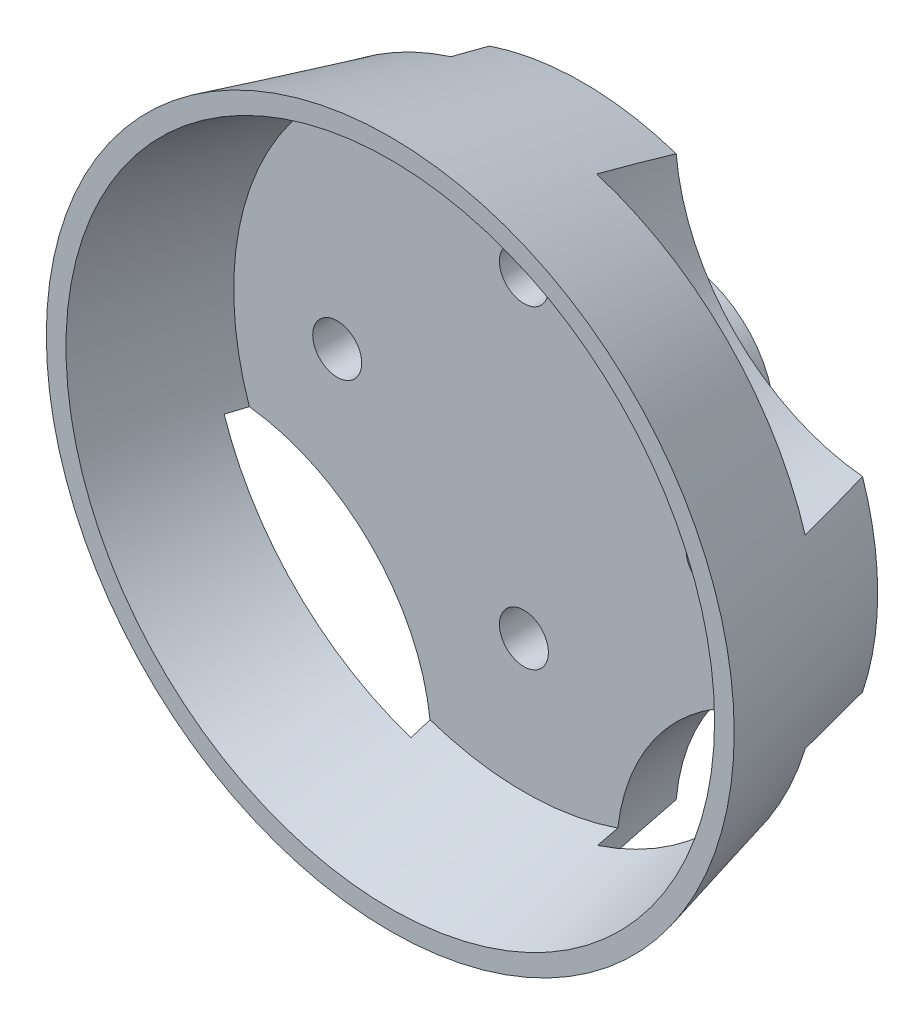
from build123d import *

# Parameters (mm, degrees)
SKETCH_2_R          = 1.245
SKETCH_2_R_2        = 10.5
CUT_EXTRUDE_1_DEPTH = 4
SKETCH_3_R          = 10.5
CUT_EXTRUDE_2_DEPTH = 2
SCALE_1_SCALE       = 0.5


with BuildPart() as part:
    # Эскиз1 → Повернуть1 (revolve)
    with BuildSketch(Plane(origin=(0, 0, 0), x_dir=(0, 0, -1), z_dir=(1, 0, 0))):
        Polygon((0, 0), (8, 0), (8, 4.75), (3, 4.75), (3, 15), (-6.8, 17.5), (-6.8, 16.5), (0, 14.765306122), align=None)
    revolve(axis=Axis((0, 0, 0), (0, 0, -1)))

    # Эскиз2 → Вырез-Вытянуть1 (cut)
    with BuildSketch(Plane(origin=(0, 0, -3), x_dir=(-1, 0, 0), z_dir=(0, 0, -1))):
        with Locations((0, 8)):
            Circle(SKETCH_2_R)
        with Locations((0, -8)):
            Circle(SKETCH_2_R)
        with Locations((9.5, 0)):
            Circle(SKETCH_2_R)
        with Locations((-9.5, 0)):
            Circle(SKETCH_2_R)
        with Locations((-15.202795796, -15.202795796)):
            Circle(SKETCH_2_R_2)
        with Locations((-15.202795796, 15.202795796)):
            Circle(SKETCH_2_R_2)
        with Locations((15.202795796, -15.202795796)):
            Circle(SKETCH_2_R_2)
    extrude(amount=-CUT_EXTRUDE_1_DEPTH, mode=Mode.SUBTRACT)

    # Эскиз3 → Вырез-Вытянуть2 (cut)
    with BuildSketch(Plane(origin=(0, 0, -3), x_dir=(-1, 0, 0), z_dir=(0, 0, -1))):
        with Locations((15.202795796, 15.202795796)):
            Circle(SKETCH_3_R)
    extrude(amount=-CUT_EXTRUDE_2_DEPTH, mode=Mode.SUBTRACT)


with BuildPart() as part_1:
    # Масштаб1: scaled about (-0.215998456, 0.215998459, -0.769715911)
    add(part.part.scale(SCALE_1_SCALE).moved(Location((-0.107999228, 0.10799923, -0.384857956))))


solid = part_1.part
